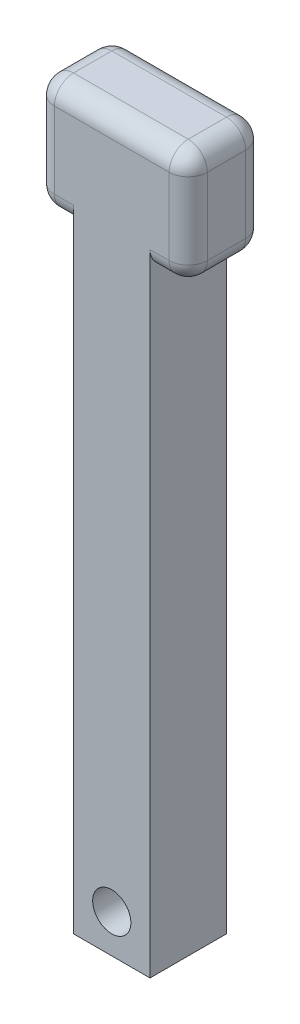
from build123d import *

# Parameters (mm, degrees)
SZKIC1_W                    = 1
SZKIC1_H                    = 1
DODANIE_WYCI_GNI_CIE2_DEPTH = 9.5
SZKIC2_R                    = 0.250044668
WYTNIJ_WYCI_GNI_CIE1_DEPTH  = 9.5
SZKIC3_W                    = 1
SZKIC3_H                    = 1.5
DODANIE_WYCI_GNI_CIE3_DEPTH = 0.5
SZKIC4_W                    = 1
SZKIC4_H                    = 1.498354428
DODANIE_WYCI_GNI_CIE4_DEPTH = 0.5
ZAOKR_GLENIE1_R             = 0.25
ZAOKR_GLENIE2_R             = 0.25


with BuildPart() as part:
    # Szkic1 → Dodanie-wyciągnięcie2 (new body)
    with BuildSketch(Plane(origin=(0, 0, 0), x_dir=(1, 0, 0), z_dir=(0, 1, 0))):
        Rectangle(SZKIC1_W, SZKIC1_H)
    extrude(amount=DODANIE_WYCI_GNI_CIE2_DEPTH)

    # Szkic2 → Wytnij-wyciągnięcie1 (cut)
    with BuildSketch(Plane(origin=(0, 0, -0.5), x_dir=(-1, 0, 0), z_dir=(0, 0, -1))):
        with Locations((0, 0.5)):
            Circle(SZKIC2_R)
    extrude(amount=-WYTNIJ_WYCI_GNI_CIE1_DEPTH, mode=Mode.SUBTRACT)

    # Szkic3 → Dodanie-wyciągnięcie3 (add)
    with BuildSketch(Plane(origin=(0.5, 0, 0), x_dir=(0, 0, -1), z_dir=(1, 0, 0))):
        with Locations((0, 8.75)):
            Rectangle(SZKIC3_W, SZKIC3_H)
    extrude(amount=DODANIE_WYCI_GNI_CIE3_DEPTH)

    # Szkic4 → Dodanie-wyciągnięcie4 (add)
    with BuildSketch(Plane.ZY.offset(0.5)):
        with Locations((0, 8.750822786)):
            Rectangle(SZKIC4_W, SZKIC4_H)
    extrude(amount=DODANIE_WYCI_GNI_CIE4_DEPTH)

    # Zaokrąglenie1
    zaokr_glenie1_edges = [part.edges().sort_by_distance(p)[0] for p in [
        (0, 9.5, -0.5),
        (0.75, 8, 0.5),
        (0.75, 8, -0.5),
        (1, 8.75, 0.5),
        (1, 8.75, -0.5),
        (1, 9.5, 0),
        (-0.75, 8.001645572, -0.5),
        (-1, 8.750822786, -0.5),
        (-1, 8.750822786, 0.5),
        (-1, 9.5, 0),
        (0, 9.5, 0.5),
    ]]
    fillet(zaokr_glenie1_edges, radius=ZAOKR_GLENIE1_R)

    # Zaokrąglenie2
    # the kernel refuses this fillet: 0.25 mm, written as the material it takes off along each edge
    with BuildSketch(Plane(origin=(0.75, 8.25, -0.25), x_dir=(0, -1, 0), z_dir=(1, 0, 0))) as zaokr_glenie2_piece_1_section:
        Polygon((0, 0), (ZAOKR_GLENIE2_R, 0), (ZAOKR_GLENIE2_R, ZAOKR_GLENIE2_R), (0, ZAOKR_GLENIE2_R), align=None)
    zaokr_glenie2_piece_1 = extrude(amount=ZAOKR_GLENIE2_R, mode=Mode.PRIVATE)
    zaokr_glenie2_piece_1 = zaokr_glenie2_piece_1 - Plane(origin=(0.75, 8.25, -0.25), x_dir=(0, 0.7071067811865475, 0.7071067811865475), z_dir=(1, 0, 0)) * Sphere(ZAOKR_GLENIE2_R, mode=Mode.PRIVATE)
    add(zaokr_glenie2_piece_1, mode=Mode.SUBTRACT)
    with BuildSketch(Plane(origin=(-0.75, 8.251645572, -0.25), x_dir=(0, -1, 0), z_dir=(-1, 0, 0))) as zaokr_glenie2_piece_2_section:
        Polygon((0, 0), (ZAOKR_GLENIE2_R, 0), (ZAOKR_GLENIE2_R, -ZAOKR_GLENIE2_R), (0, -ZAOKR_GLENIE2_R), align=None)
    zaokr_glenie2_piece_2 = extrude(amount=ZAOKR_GLENIE2_R, mode=Mode.PRIVATE)
    zaokr_glenie2_piece_2 = zaokr_glenie2_piece_2 - Plane(origin=(-0.75, 8.251645572, -0.25), x_dir=(0, 0.7071067811865475, 0.7071067811865475), z_dir=(-1, 0, 0)) * Sphere(ZAOKR_GLENIE2_R, mode=Mode.PRIVATE)
    add(zaokr_glenie2_piece_2, mode=Mode.SUBTRACT)
    with BuildSketch(Plane(origin=(0.75, 8.25, 0.25), x_dir=(0, -1, 0), z_dir=(1, 0, 0))) as zaokr_glenie2_piece_3_section:
        Polygon((0, 0), (ZAOKR_GLENIE2_R, 0), (ZAOKR_GLENIE2_R, -ZAOKR_GLENIE2_R), (0, -ZAOKR_GLENIE2_R), align=None)
    zaokr_glenie2_piece_3 = extrude(amount=ZAOKR_GLENIE2_R, mode=Mode.PRIVATE)
    zaokr_glenie2_piece_3 = zaokr_glenie2_piece_3 - Plane(origin=(0.75, 8.25, 0.25), x_dir=(0, 0.7071067811865475, -0.7071067811865475), z_dir=(1, 0, 0)) * Sphere(ZAOKR_GLENIE2_R, mode=Mode.PRIVATE)
    add(zaokr_glenie2_piece_3, mode=Mode.SUBTRACT)
    with BuildSketch(Plane(origin=(-1, 8.001645572, 0.25), x_dir=(0, 1, 0), z_dir=(0, 0, -1)), Plane(origin=(1, 8, -0.25), x_dir=(0, 1, 0), z_dir=(0, 0, 1))) as zaokr_glenie2_piece_4:
        with BuildLine():
            CenterArc((ZAOKR_GLENIE2_R, ZAOKR_GLENIE2_R), ZAOKR_GLENIE2_R, 180, 90)
            Line((0, ZAOKR_GLENIE2_R), (0, 0))
            Line((0, 0), (ZAOKR_GLENIE2_R, 0))
        make_face()
    extrude(amount=0.5, mode=Mode.SUBTRACT)
    with BuildSketch(Plane(origin=(-0.5, 8.001645572, 0.5), x_dir=(0, 1, 0), z_dir=(-1, 0, 0))) as zaokr_glenie2_piece_5:
        with BuildLine():
            CenterArc((ZAOKR_GLENIE2_R, ZAOKR_GLENIE2_R), ZAOKR_GLENIE2_R, 180, 90)
            Line((0, ZAOKR_GLENIE2_R), (0, 0))
            Line((0, 0), (ZAOKR_GLENIE2_R, 0))
        make_face()
    extrude(amount=0.25, mode=Mode.SUBTRACT)
    with BuildSketch(Plane(origin=(-0.75, 8.001645572, 0.25), x_dir=(0, 0, 1), z_dir=(1, 0, 0))) as zaokr_glenie2_piece_6:
        with BuildLine():
            CenterArc((0.25 - ZAOKR_GLENIE2_R, -ZAOKR_GLENIE2_R), ZAOKR_GLENIE2_R, 0, 90)
            Line((0.25 - ZAOKR_GLENIE2_R, 0), (0.25, 0))
            Line((0.25, 0), (0.25, -ZAOKR_GLENIE2_R))
        make_face()
    revolve(axis=Axis((-0.75, 8.001645572, 0.25), (0, -1, 0)), revolution_arc=90, mode=Mode.SUBTRACT)


solid = part.part
